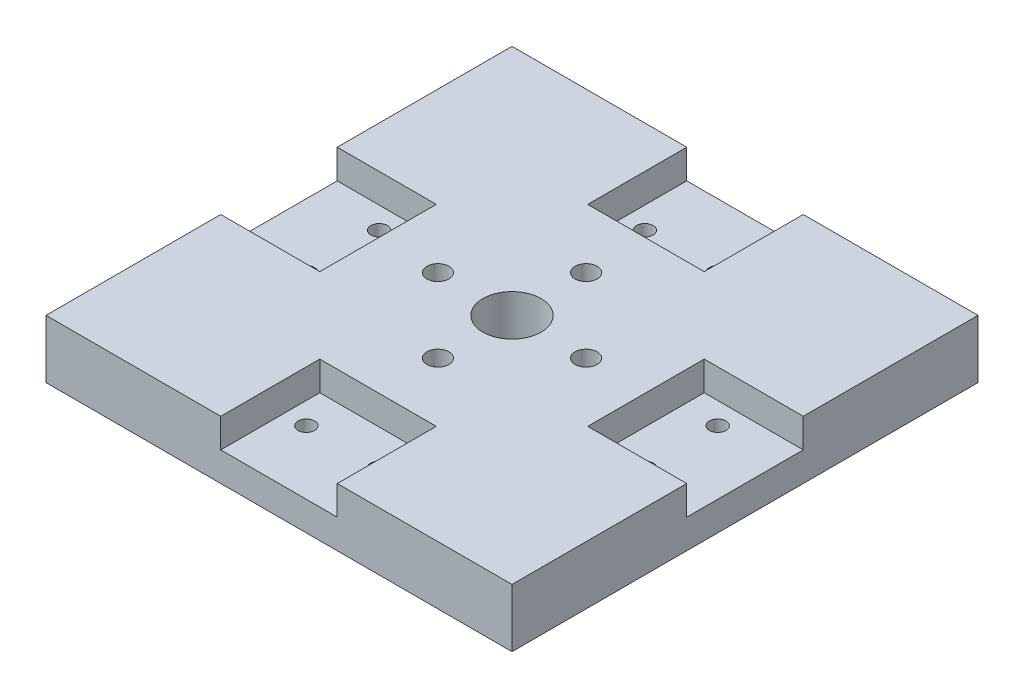
from build123d import *

# Parameters (mm, degrees)
SKETCH1_W           = 101.6
SKETCH1_H           = 101.6
BOSS_EXTRUDE1_DEPTH = 12.7
SKETCH2_W           = 25.4
SKETCH2_H           = 21.59
SKETCH2_W_2         = 21.59
SKETCH2_H_2         = 25.4
CUT_EXTRUDE1_DEPTH  = 6.35
SKETCH3_R           = 2.400000026
CUT_EXTRUDE2_DEPTH  = 145.244271983
SKETCH4_R           = 1.8034
CUT_EXTRUDE3_DEPTH  = 144.824345992
SKETCH5_R           = 6.35
CUT_EXTRUDE4_DEPTH  = 145.244271983


with BuildPart() as part:
    # Sketch1 → Boss-Extrude1 (new body)
    with BuildSketch(Plane(origin=(0, 0, 0), x_dir=(1, 0, 0), z_dir=(0, 1, 0))):
        with Locations((50.8, 50.8)):
            Rectangle(SKETCH1_W, SKETCH1_H)
    extrude(amount=BOSS_EXTRUDE1_DEPTH)

    # Sketch2 → Cut-Extrude1 (cut)
    with BuildSketch(Plane(origin=(0, 12.7, 0), x_dir=(1, 0, 0), z_dir=(0, 1, 0))):
        with Locations((50.8, 90.805)):
            Rectangle(SKETCH2_W, SKETCH2_H)
        with Locations((10.795, 50.8)):
            Rectangle(SKETCH2_W_2, SKETCH2_H_2)
        with Locations((50.8, 10.795)):
            Rectangle(SKETCH2_W, SKETCH2_H)
        with Locations((90.805, 50.8)):
            Rectangle(SKETCH2_W_2, SKETCH2_H_2)
    extrude(amount=-CUT_EXTRUDE1_DEPTH, mode=Mode.SUBTRACT)

    # Sketch3 → Cut-Extrude2 (cut, through all)
    with BuildSketch(Plane(origin=(0, 12.7, 0), x_dir=(1, 0, 0), z_dir=(0, 1, 0))):
        with Locations((34.65068, 50.8)):
            Circle(SKETCH3_R)
        with Locations((50.8, 66.94932)):
            Circle(SKETCH3_R)
        with Locations((66.94932, 50.8)):
            Circle(SKETCH3_R)
        with Locations((50.8, 34.65068)):
            Circle(SKETCH3_R)
    extrude(amount=-CUT_EXTRUDE2_DEPTH, mode=Mode.SUBTRACT)

    # Sketch4 → Cut-Extrude3 (cut, through all)
    with BuildSketch(Plane(origin=(0, 6.35, 0), x_dir=(1, 0, 0), z_dir=(0, 1, 0))):
        with Locations((87.7062, 58.7375)):
            Circle(SKETCH4_R)
        with Locations((87.7062, 42.8625)):
            Circle(SKETCH4_R)
        with Locations((58.7375, 87.7062)):
            Circle(SKETCH4_R)
        with Locations((42.8625, 87.7062)):
            Circle(SKETCH4_R)
        with Locations((13.8938, 58.7375)):
            Circle(SKETCH4_R)
        with Locations((13.8938, 42.8625)):
            Circle(SKETCH4_R)
        with Locations((42.8625, 13.8938)):
            Circle(SKETCH4_R)
        with Locations((58.7375, 13.8938)):
            Circle(SKETCH4_R)
    extrude(amount=-CUT_EXTRUDE3_DEPTH, mode=Mode.SUBTRACT)

    # Sketch5 → Cut-Extrude4 (cut, through all)
    with BuildSketch(Plane(origin=(0, 12.7, 0), x_dir=(1, 0, 0), z_dir=(0, 1, 0))):
        with Locations((50.8, 50.8)):
            Circle(SKETCH5_R)
    extrude(amount=-CUT_EXTRUDE4_DEPTH, mode=Mode.SUBTRACT)


solid = part.part
